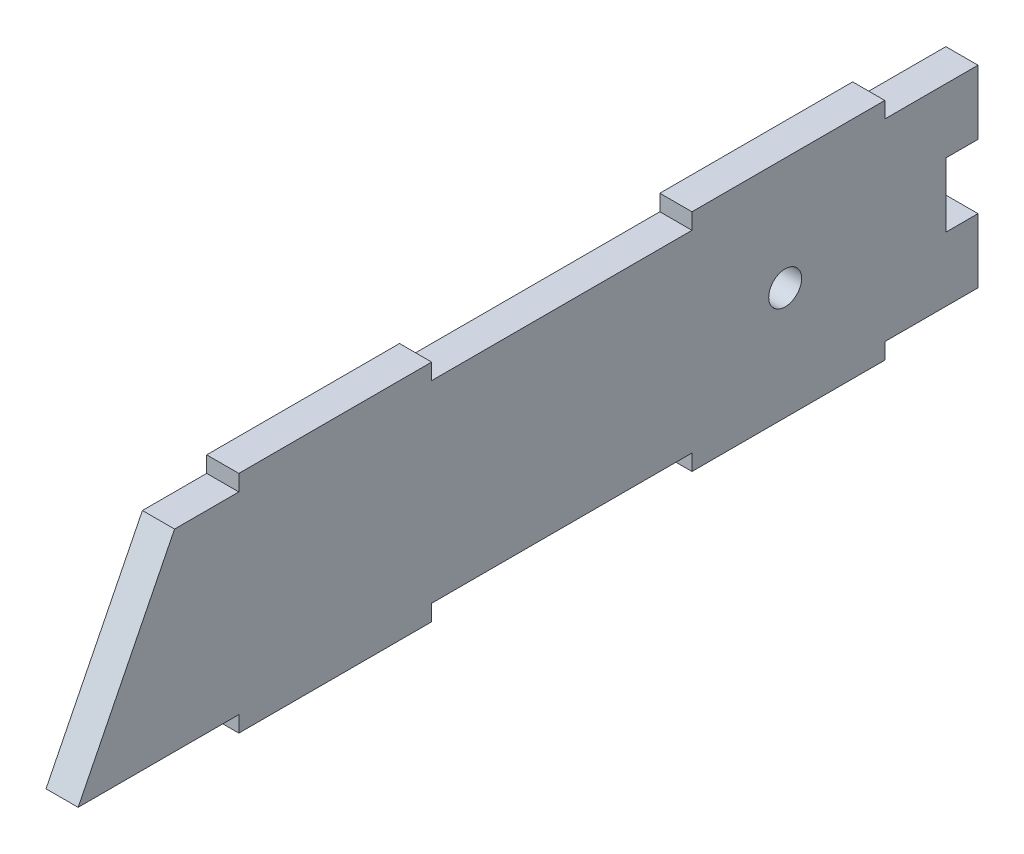
from build123d import *

# Parameters (mm, degrees)
SKETCH1_W               = 355.6
SKETCH1_H               = 76.2
BOSS_EXTRUDE1_DEPTH     = 12.7
CUT_EXTRUDE1_DEPTH      = 183.279291199
CUT_EXTRUDE1_DEPTH_BACK = 183.279291199
SKETCH3_W               = 76.2
SKETCH3_H               = 6.35
BOSS_EXTRUDE2_DEPTH     = 12.7
SKETCH4_W               = 12.7
SKETCH4_H               = 25.4
CUT_EXTRUDE2_DEPTH      = 184.711546997
SKETCH5_R               = 6.5
CUT_EXTRUDE3_DEPTH      = 184.711546997


with BuildPart() as part:
    # Sketch1 → Boss-Extrude1 (new body)
    with BuildSketch(Plane(origin=(0, 0, 0), x_dir=(0, 0, -1), z_dir=(1, 0, 0))):
        Rectangle(SKETCH1_W, SKETCH1_H)
    extrude(amount=BOSS_EXTRUDE1_DEPTH)

    # Sketch2 → Cut-Extrude1 (cut, two sides: drawn at the far end of the back side and taken through both)
    with BuildSketch(Plane(origin=(12.7, 0, 0), x_dir=(0, 0, -1), z_dir=(1, 0, 0)).offset(-CUT_EXTRUDE1_DEPTH_BACK)):
        Polygon((-507.550847217, -697.601694433), (-177.8, -38.1), (-139.7, 38.1), (190.050847217, 697.601694433), (-1128.95254165, 1357.103388866), (-1826.554236083, -38.1), align=None)
    extrude(amount=CUT_EXTRUDE1_DEPTH + CUT_EXTRUDE1_DEPTH_BACK, mode=Mode.SUBTRACT)

    # Sketch3 → Boss-Extrude2 (add)
    with BuildSketch(Plane.ZY):
        with Locations((-102.87, -41.275)):
            Rectangle(SKETCH3_W, SKETCH3_H)
        with Locations((76.2, -41.275)):
            Rectangle(SKETCH3_W, SKETCH3_H)
        with Locations((-102.87, 41.275)):
            Rectangle(SKETCH3_W, SKETCH3_H)
        with Locations((76.2, 41.275)):
            Rectangle(SKETCH3_W, SKETCH3_H)
    extrude(amount=-BOSS_EXTRUDE2_DEPTH)

    # Sketch4 → Cut-Extrude2 (cut, through all)
    with BuildSketch(Plane.ZY):
        with Locations((-171.45, 0)):
            Rectangle(SKETCH4_W, SKETCH4_H)
    extrude(amount=-CUT_EXTRUDE2_DEPTH, mode=Mode.SUBTRACT)

    # Sketch5 → Cut-Extrude3 (cut, through all)
    with BuildSketch(Plane.ZY):
        with Locations((-101.6, 0)):
            Circle(SKETCH5_R)
    extrude(amount=-CUT_EXTRUDE3_DEPTH, mode=Mode.SUBTRACT)


solid = part.part
